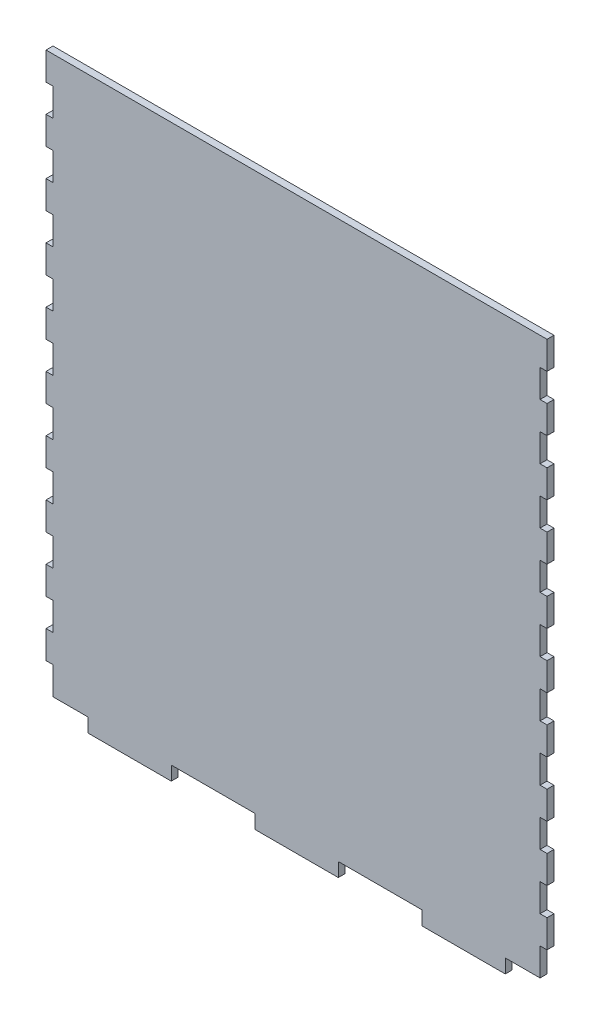
from build123d import *

# Parameters (mm, degrees)
BOSS_EXTRUDE1_DEPTH = 3.175


with BuildPart() as part:
    # Sketch1 → Boss-Extrude1 (new body)
    with BuildSketch(Plane.XY):
        Polygon((-114.3, 127), (-114.3, 114.3), (-111.125, 114.3), (-111.125, 101.6), (-114.3, 101.6), (-114.3, 88.9), (-111.125, 88.9), (-111.125, 76.2), (-114.3, 76.2), (-114.3, 63.5), (-111.125, 63.5), (-111.125, 50.8), (-114.3, 50.8), (-114.3, 38.1), (-111.125, 38.1), (-111.125, 25.4), (-114.3, 25.4), (-114.3, 12.7), (-111.125, 12.7), (-111.125, 0), (-114.3, 0), (-114.3, -12.7), (-111.125, -12.7), (-111.125, -25.4), (-114.3, -25.4), (-114.3, -38.1), (-111.125, -38.1), (-111.125, -50.8), (-114.3, -50.8), (-114.3, -63.5), (-111.125, -63.5), (-111.125, -76.2), (-114.3, -76.2), (-114.3, -88.9), (-111.125, -88.9), (-111.125, -101.6), (-114.3, -101.6), (-114.3, -114.3), (-111.125, -114.3), (-111.125, -127), (-95.25, -127), (-95.25, -133.35), (-57.15, -133.35), (-57.15, -127), (-19.05, -127), (-19.05, -133.35), (19.05, -133.35), (19.05, -127), (57.15, -127), (57.15, -133.35), (95.25, -133.35), (95.25, -127), (111.125, -127), (111.125, -114.3), (114.3, -114.3), (114.3, -101.6), (111.125, -101.6), (111.125, -88.9), (114.3, -88.9), (114.3, -76.2), (111.125, -76.2), (111.125, -63.5), (114.3, -63.5), (114.3, -50.8), (111.125, -50.8), (111.125, -38.1), (114.3, -38.1), (114.3, -25.4), (111.125, -25.4), (111.125, -12.7), (114.3, -12.7), (114.3, 0), (111.125, 0), (111.125, 12.7), (114.3, 12.7), (114.3, 25.4), (111.125, 25.4), (111.125, 38.1), (114.3, 38.1), (114.3, 50.8), (111.125, 50.8), (111.125, 63.5), (114.3, 63.5), (114.3, 76.2), (111.125, 76.2), (111.125, 88.9), (114.3, 88.9), (114.3, 101.6), (111.125, 101.6), (111.125, 114.3), (114.3, 114.3), (114.3, 127), align=None)
    extrude(amount=BOSS_EXTRUDE1_DEPTH)


solid = part.part
